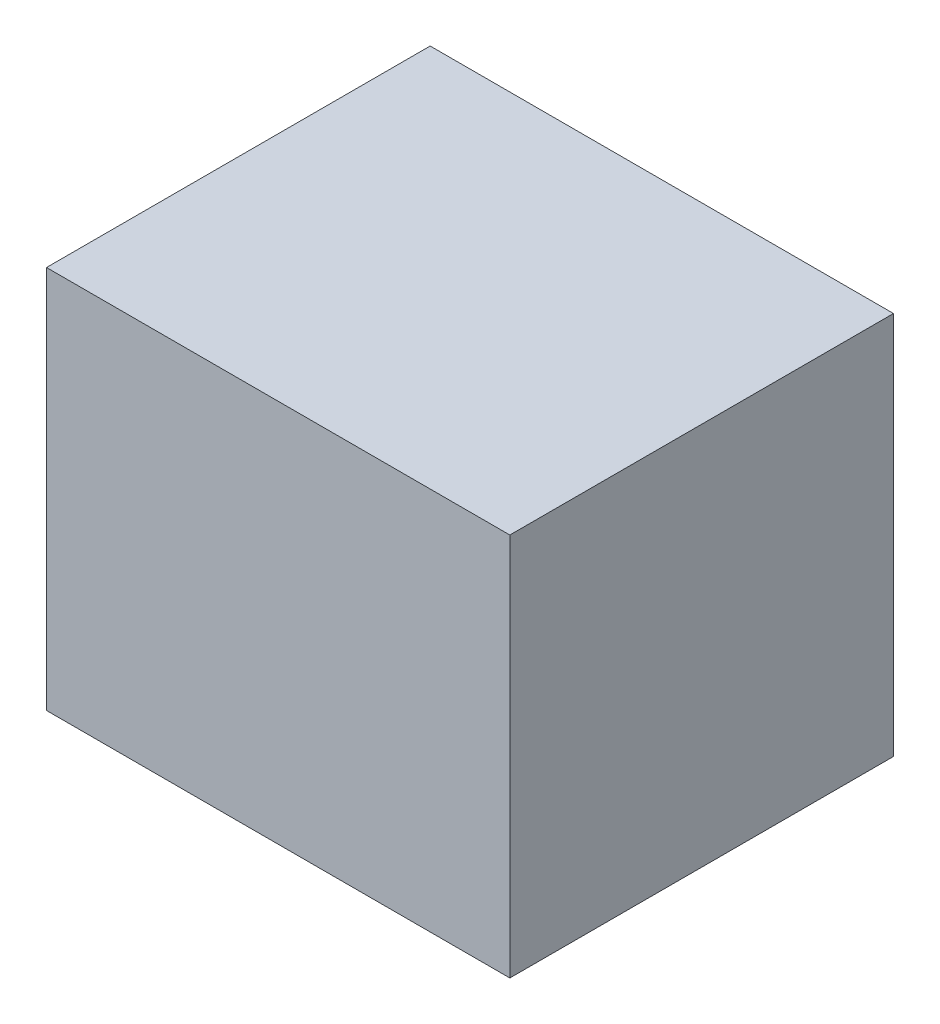
from build123d import *

# Parameters (mm, degrees)
SKIZZE1_W                       = 78.5
SKIZZE1_H                       = 65
AUFSATZ_LINEAR_AUSTRAGEN1_DEPTH = 65


with BuildPart() as part:
    # Skizze1 → Aufsatz-Linear austragen1 (new body)
    with BuildSketch(Plane.XY):
        Rectangle(SKIZZE1_W, SKIZZE1_H)
    extrude(amount=AUFSATZ_LINEAR_AUSTRAGEN1_DEPTH)


solid = part.part
